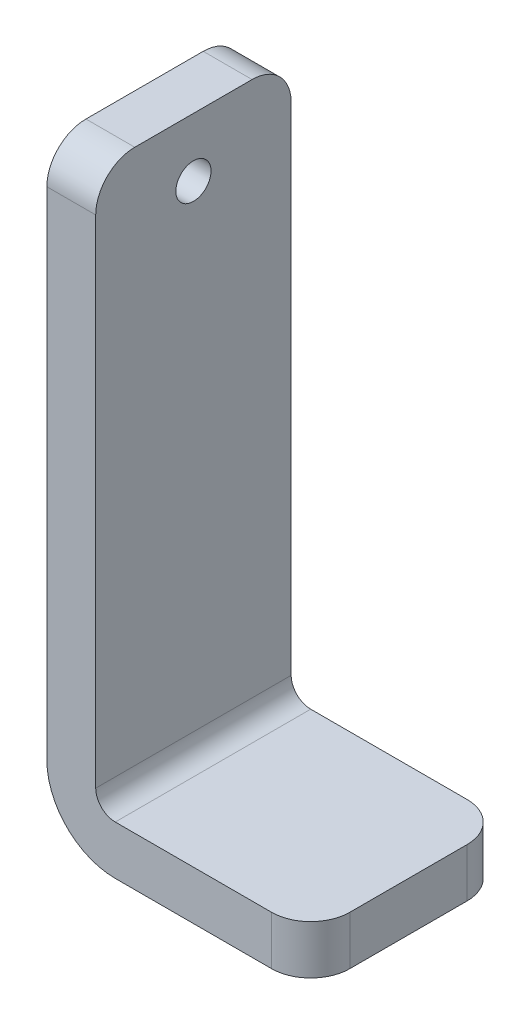
from build123d import *

# Parameters (mm, degrees)
BOSS_EXTRUDE1_DEPTH = 12.7
CUT_EXTRUDE1_REACH  = 33.423
SKETCH2_R           = 1.143
FILLET1_R           = 2.54


with BuildPart() as part:
    # Sketch1 → Boss-Extrude1 (new body)
    with BuildSketch(Plane.XY):
        with BuildLine():
            Line((0, 23.06825917), (0, -11.72974083))
            ThreePointArc((0, -11.72974083), (0.371974388, -12.627766442), (1.27, -12.99974083))
            Line((1.27, -12.99974083), (13.97, -12.99974083))
            Line((13.97, -12.99974083), (13.97, -16.17474083))
            Line((13.97, -16.17474083), (1.27, -16.17474083))
            ThreePointArc((1.27, -16.17474083), (-1.873089642, -14.872830472), (-3.175, -11.72974083))
            Line((-3.175, -11.72974083), (-3.175, 23.06825917))
            Line((-3.175, 23.06825917), (0, 23.06825917))
        make_face()
    extrude(amount=BOSS_EXTRUDE1_DEPTH)

    # Sketch2 → Cut-Extrude1 (cut, up to next)
    with BuildSketch(Plane.ZY.offset(3.175), mode=Mode.PRIVATE) as cut_extrude1_sk1:
        with Locations((6.35, 19.25825917)):
            Circle(SKETCH2_R)
    cut_extrude1_tool1 = extrude(cut_extrude1_sk1.sketch, amount=-CUT_EXTRUDE1_REACH, mode=Mode.PRIVATE) & part.part
    add(cut_extrude1_tool1.solids().sort_by_distance((-3.175, 19.258259, 6.35))[0], mode=Mode.SUBTRACT)

    # Fillet1
    fillet1_edges = [part.edges().sort_by_distance(p)[0] for p in [
        (13.97, -14.58724083, 0),
        (13.97, -14.58724083, 12.7),
        (-1.5875, 23.06825917, 0),
        (-1.5875, 23.06825917, 12.7),
    ]]
    fillet(fillet1_edges, radius=FILLET1_R)


solid = part.part
